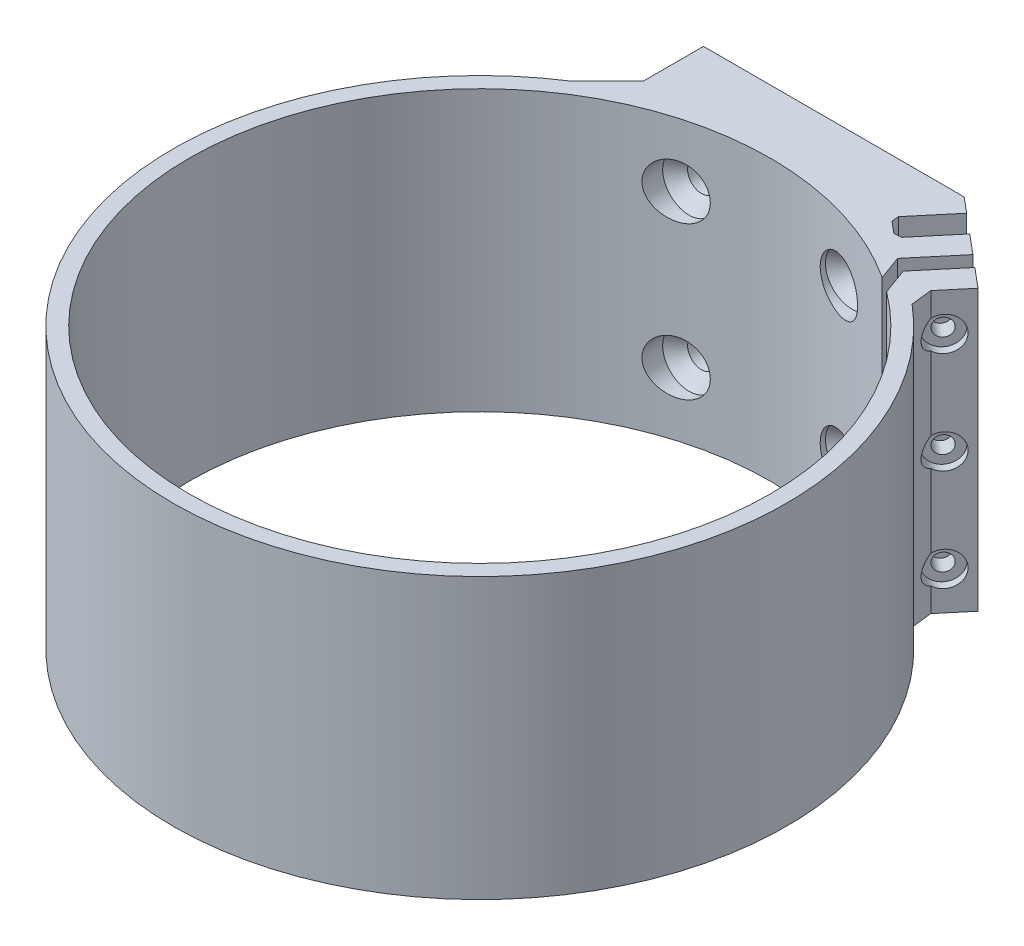
from build123d import *

# Parameters (mm, degrees)
BOSS_EXTRUDE1_DEPTH                            = 27.5
CBORE_FOR_M3_SBHCS1_D                          = 3.4
CBORE_FOR_M3_SBHCS1_DEPTH                      = 14.9999954
CBORE_FOR_M3_SBHCS1_CBORE_D                    = 6.7
CBORE_FOR_M3_SBHCS1_CBORE_DEPTH                = 1.65
CBORE_FOR_M3_SBHCS1_TIP                        = 1.021463052
SKETCH4_W                                      = 41.25
SKETCH4_H                                      = 7.273611758
BOSS_EXTRUDE2_DEPTH                            = 4.5
CSK_FOR_M5_FLAT_HEAD_MACHINE_SCREW1_AT_2_COUNT = 2
CSK_FOR_M5_FLAT_HEAD_MACHINE_SCREW1_AT_2_PITCH = 32
CSK_FOR_M5_FLAT_HEAD_MACHINE_SCREW1_AT_3_COUNT = 2
CSK_FOR_M5_FLAT_HEAD_MACHINE_SCREW1_AT_3_PITCH = 43.863424399
CSK_FOR_M5_FLAT_HEAD_MACHINE_SCREW1_AT_4_COUNT = 2
CSK_FOR_M5_FLAT_HEAD_MACHINE_SCREW1_AT_4_PITCH = 30
CUT_EXTRUDE1_REACH                             = 136.892
CUT_EXTRUDE1_END_RADIUS                        = 57.15
SKETCH13_R                                     = 5.2
CHAMFER1_START                                 = -27.5
CHAMFER1_DEPTH                                 = 55
CHAMFER1_START_2                               = -3.038209282
CHAMFER1_2_OUTLINE_R                           = 3.35
CHAMFER1_2_DEPTH                               = 1.570474688
CHAMFER2_SIZE                                  = 1


with BuildPart() as part:
    # Sketch1 → Boss-Extrude1 (new, symmetric)
    with BuildSketch(Plane(origin=(0, 0, 0), x_dir=(1, 0, 0), z_dir=(0, 1, 0))):
        with BuildLine():
            Line((-25.625, 54.611949242), (-25.625, 69.598611758))
            Line((-25.625, 69.598611758), (-20.625, 69.598611758))
            Line((-20.625, 69.598611758), (-20.625, 62.325))
            Line((-20.625, 62.325), (20.625, 62.325))
            Line((20.625, 62.325), (20.625, 69.598611758))
            Line((20.625, 69.598611758), (25.625, 69.598611758))
            Line((25.625, 69.598611758), (28.64505971, 67.064480768))
            Line((28.64505971, 67.064480768), (21.893060118, 59.017760997))
            Line((21.893060118, 59.017760997), (25.723282334, 55.803822949))
            Line((25.723282334, 55.803822949), (32.475281926, 63.85054272))
            Line((32.475281926, 63.85054272), (36.305504142, 60.636604672))
            Line((36.305504142, 60.636604672), (29.553504549, 52.5898849))
            Line((29.553504549, 52.5898849), (31.287947409, 47.824542307))
            ThreePointArc((31.287947409, 47.824542307), (-32.73018113, -46.849308887), (34.142039673, 45.830597061))
            Line((34.142039673, 45.830597061), (32.272757303, 50.966408163))
            Line((32.272757303, 50.966408163), (38.7006334, 58.626852595))
            Line((38.7006334, 58.626852595), (42.530855615, 55.412914546))
            Line((42.530855615, 55.412914546), (36.399549462, 48.10590841))
            ThreePointArc((36.399549462, 48.10590841), (-6.293240092, -59.995839474), (-25.625, 54.611949242))
        make_face()
    extrude(amount=BOSS_EXTRUDE1_DEPTH, both=True)

    # CBORE for M3 SBHCS1
    with Locations(Plane(origin=(-2.327403337, 0, -1.952923282), x_dir=(0.6427876096865344, 0, -0.7660444431189822), z_dir=(0.7660444431189822, 0, 0.6427876096865344))):
        with Locations((65.056031142, 20), (65.056031142, 0), (65.056031142, -20)):
            CounterBoreHole(CBORE_FOR_M3_SBHCS1_D / 2, CBORE_FOR_M3_SBHCS1_CBORE_D / 2, CBORE_FOR_M3_SBHCS1_CBORE_DEPTH, depth=CBORE_FOR_M3_SBHCS1_DEPTH)
            with Locations((0, 0, -(CBORE_FOR_M3_SBHCS1_DEPTH + CBORE_FOR_M3_SBHCS1_TIP / 2))):  # 118° drill point
                Cone(0, CBORE_FOR_M3_SBHCS1_D / 2, CBORE_FOR_M3_SBHCS1_TIP, mode=Mode.SUBTRACT)

    # Sketch4 → Boss-Extrude2 (add)
    with BuildSketch(Plane.XZ.offset(-27.5)):
        with Locations((0, -65.961805879)):
            Rectangle(SKETCH4_W, SKETCH4_H)
    extrude(amount=BOSS_EXTRUDE2_DEPTH)

    # Sketch12 → CSK for M5 Flat Head Machine Screw1 (revolve, cut)
    with BuildSketch(Plane(origin=(-16, 15, -57.15), x_dir=(0, -1, 0), z_dir=(1, 0, 0))):
        Polygon((0, 0), (0, 12.448611758), (2.75, 12.448611758), (2.75, 2.45), (5.2, 0), align=None)
    csk_for_m5_flat_head_machine_screw1 = revolve(axis=Axis((-16, 15, -50.8), (0, 0, -1)), mode=Mode.SUBTRACT)

    # CSK for M5 Flat Head Machine Screw1 at 2: CSK for M5 Flat Head Machine Screw1 ×2
    with Locations(*[(i * CSK_FOR_M5_FLAT_HEAD_MACHINE_SCREW1_AT_2_PITCH, 0, 0) for i in range(1, CSK_FOR_M5_FLAT_HEAD_MACHINE_SCREW1_AT_2_COUNT)]):
        add(csk_for_m5_flat_head_machine_screw1, mode=Mode.SUBTRACT)

    # CSK for M5 Flat Head Machine Screw1 at 3: CSK for M5 Flat Head Machine Screw1 ×2
    with Locations(*[Vector(0.7295372041400852, -0.6839411288813297, 0) * (i * CSK_FOR_M5_FLAT_HEAD_MACHINE_SCREW1_AT_3_PITCH) for i in range(1, CSK_FOR_M5_FLAT_HEAD_MACHINE_SCREW1_AT_3_COUNT)]):
        add(csk_for_m5_flat_head_machine_screw1, mode=Mode.SUBTRACT)

    # CSK for M5 Flat Head Machine Screw1 at 4: CSK for M5 Flat Head Machine Screw1 ×2
    with Locations(*[(0, -i * CSK_FOR_M5_FLAT_HEAD_MACHINE_SCREW1_AT_4_PITCH, 0) for i in range(1, CSK_FOR_M5_FLAT_HEAD_MACHINE_SCREW1_AT_4_COUNT)]):
        add(csk_for_m5_flat_head_machine_screw1, mode=Mode.SUBTRACT)

    # Cut-Extrude1: up to this cylinder (the profile starts outside it)
    cut_extrude1_end = Plane(origin=(0, 0, 0), z_dir=(0, -1, 0)) * Cylinder(CUT_EXTRUDE1_END_RADIUS, 419.084, mode=Mode.PRIVATE)
    # Sketch13 → Cut-Extrude1 (cut, up to the surface)
    with BuildSketch(Plane.XY.offset(-57.15), mode=Mode.PRIVATE) as cut_extrude1_sk1:
        with Locations(Location((-16, -15, 0), (0, 0, 180))):
            Circle(SKETCH13_R)
    cut_extrude1_tool1 = extrude(cut_extrude1_sk1.sketch, amount=CUT_EXTRUDE1_REACH, mode=Mode.PRIVATE) - cut_extrude1_end
    add(cut_extrude1_tool1.solids().sort_by_distance((-16, -15, -57.15))[0], mode=Mode.SUBTRACT)
    # Sketch13 → Cut-Extrude1 (cut, up to the surface)
    with BuildSketch(Plane.XY.offset(-57.15), mode=Mode.PRIVATE) as cut_extrude1_sk2:
        with Locations(Location((16, -15, 0), (0, 0, 180))):
            Circle(SKETCH13_R)
    cut_extrude1_tool2 = extrude(cut_extrude1_sk2.sketch, amount=CUT_EXTRUDE1_REACH, mode=Mode.PRIVATE) - cut_extrude1_end
    add(cut_extrude1_tool2.solids().sort_by_distance((16, -15, -57.15))[0], mode=Mode.SUBTRACT)
    # Sketch13 → Cut-Extrude1 (cut, up to the surface)
    with BuildSketch(Plane.XY.offset(-57.15), mode=Mode.PRIVATE) as cut_extrude1_sk3:
        with Locations(Location((16, 15, 0), (0, 0, 180))):
            Circle(SKETCH13_R)
    cut_extrude1_tool3 = extrude(cut_extrude1_sk3.sketch, amount=CUT_EXTRUDE1_REACH, mode=Mode.PRIVATE) - cut_extrude1_end
    add(cut_extrude1_tool3.solids().sort_by_distance((16, 15, -57.15))[0], mode=Mode.SUBTRACT)
    # Sketch13 → Cut-Extrude1 (cut, up to the surface)
    with BuildSketch(Plane.XY.offset(-57.15), mode=Mode.PRIVATE) as cut_extrude1_sk4:
        with Locations(Location((-16, 15, 0), (0, 0, 180))):
            Circle(SKETCH13_R)
    cut_extrude1_tool4 = extrude(cut_extrude1_sk4.sketch, amount=CUT_EXTRUDE1_REACH, mode=Mode.PRIVATE) - cut_extrude1_end
    add(cut_extrude1_tool4.solids().sort_by_distance((-16, 15, -57.15))[0], mode=Mode.SUBTRACT)

    # Chamfer1: read off the stored shape, not the designer's step
    # Chamfer1 outline → Chamfer1 (add)
    with BuildSketch(Plane(origin=(0, 0, 0), x_dir=(1, 0, 0), z_dir=(0, 1, 0)).offset(CHAMFER1_START)):
        with BuildLine():
            ThreePointArc((36.399549462, 48.10590841), (37.595386052, 47.177246344), (38.767539596, 46.218865181))
            Line((38.767539596, 46.218865181), (38.293658487, 50.363219646))
            Line((38.293658487, 50.363219646), (36.399549462, 48.10590841))
        make_face()
        with BuildLine():
            Line((-25.625, 57.786949242), (-32.752511971, 50.659437271))
            ThreePointArc((-32.752511971, 50.659437271), (-29.255581753, 52.756199269), (-25.625, 54.611949242))
            Line((-25.625, 54.611949242), (-25.625, 57.786949242))
        make_face()
    extrude(amount=CHAMFER1_DEPTH)

    # Chamfer1 2 outline → Chamfer1 2 (cut)
    with BuildSketch(Plane(origin=(0, 0, 0), x_dir=(0.642787609686534, 0, -0.7660444431189825), z_dir=(0.7660444431189823, 0, 0.6427876096865344)).offset(CHAMFER1_START_2)):
        with Locations((65.056031142, -20)):
            Circle(CHAMFER1_2_OUTLINE_R)
        with Locations((65.056031142, 0)):
            Circle(CHAMFER1_2_OUTLINE_R)
        with Locations((65.056031142, 20)):
            Circle(CHAMFER1_2_OUTLINE_R)
    extrude(amount=CHAMFER1_2_DEPTH, mode=Mode.SUBTRACT)

    # Chamfer2
    chamfer2_edges = [part.edges().sort_by_distance(p)[0] for p in [
        (21.893060118, 0, -59.017760997),
        (25.723282334, 0, -55.803822949),
    ]]
    chamfer(chamfer2_edges, length=CHAMFER2_SIZE)


solid = part.part
